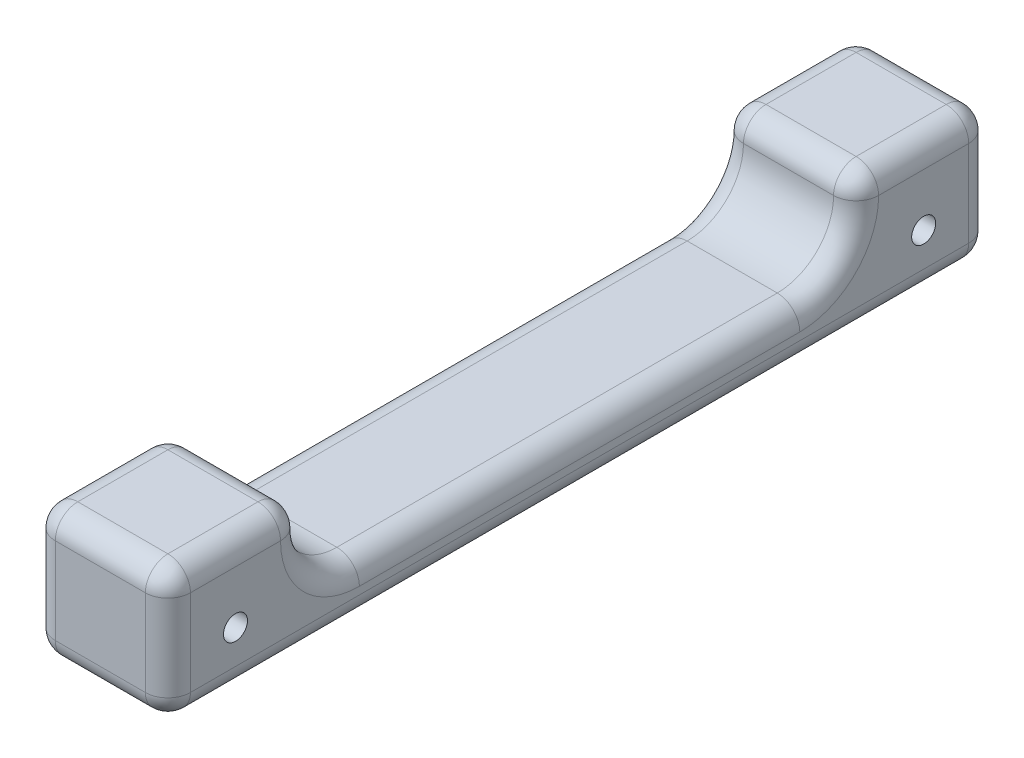
from build123d import *

# Parameters (mm, degrees)
SKETCH_1_W               = 18
SKETCH_1_H               = 18
SKETCH_1_W_2             = 12.4
SKETCH_1_H_2             = 12.4
EXTRUDE_1_DEPTH          = 15
SKETCH_2_W               = 18
SKETCH_2_H               = 18
EXTRUDE_1_2_DEPTH        = 2.5
FILLET_1_R               = 3
SKETCH_3_W               = 18
SKETCH_3_H               = 7
EXTRUDE_2_DEPTH          = 36.83
FILLET_2_R               = 7.5
FILLET_3_R               = 3
CUT_EXTRUDE_1_DEPTH      = 37
CUT_EXTRUDE_1_DEPTH_BACK = 37
SKETCH_6_R               = 1.6
FILLET_4_R               = 3


# Some blends are built 0.0001 mm under size
with BuildPart() as part:
    # 草图1 → Extrude 1 (new body)
    with BuildSketch(Plane(origin=(0, 0, 0), x_dir=(1, 0, 0), z_dir=(0, 1, 0))):
        Rectangle(SKETCH_1_W, SKETCH_1_H)
        Rectangle(SKETCH_1_W_2, SKETCH_1_H_2, mode=Mode.SUBTRACT)
    extrude(amount=EXTRUDE_1_DEPTH)

    # 草图2 → Extrude 1 2 (add)
    with BuildSketch(Plane(origin=(0, 15, 0), x_dir=(1, 0, 0), z_dir=(0, 1, 0))):
        Rectangle(SKETCH_2_W, SKETCH_2_H)
    extrude(amount=EXTRUDE_1_2_DEPTH)

    # 圆角1
    fillet_1_edges = [part.edges().sort_by_distance(p)[0] for p in [
        (-9, 17.5, 0),
        (0, 17.5, 9),
        (9, 17.5, 0),
        (0, 17.5, -9),
    ]]
    fillet(fillet_1_edges, radius=FILLET_1_R)

    # 草图3 → 凸台-拉伸2 (add)
    with BuildSketch(Plane.XY.offset(9)):
        with Locations((0, 3.5)):
            Rectangle(SKETCH_3_W, SKETCH_3_H)
    extrude(amount=EXTRUDE_2_DEPTH)

    # 圆角2
    fillet_2_edges = [part.edges().sort_by_distance(p)[0] for p in [
        (0, 7, 9),
    ]]
    fillet(fillet_2_edges, radius=FILLET_2_R - 0.0001)  # a hair under: the kernel refuses the full size

    # 圆角3
    # the kernel refuses this fillet: 3 mm, written as the material it takes off along each edge
    with BuildSketch(Plane(origin=(6, 14.5, -6), x_dir=(0, 0, -1), z_dir=(1, 0, 0))) as fillet_3_piece_1_section:
        Polygon((0, 0), (FILLET_3_R, 0), (FILLET_3_R, FILLET_3_R), (0, FILLET_3_R), align=None)
    fillet_3_piece_1 = extrude(amount=FILLET_3_R, mode=Mode.PRIVATE)
    fillet_3_piece_1 = fillet_3_piece_1 - Plane(origin=(6, 14.5, -6), x_dir=(0, -0.7071067811865475, 0.7071067811865475), z_dir=(1, 0, 0)) * Sphere(FILLET_3_R, mode=Mode.PRIVATE)
    add(fillet_3_piece_1, mode=Mode.SUBTRACT)
    with BuildSketch(Plane(origin=(-6, 14.5, -6), x_dir=(0, 0, -1), z_dir=(-1, 0, 0))) as fillet_3_piece_2_section:
        Polygon((0, 0), (FILLET_3_R, 0), (FILLET_3_R, -FILLET_3_R), (0, -FILLET_3_R), align=None)
    fillet_3_piece_2 = extrude(amount=FILLET_3_R, mode=Mode.PRIVATE)
    fillet_3_piece_2 = fillet_3_piece_2 - Plane(origin=(-6, 14.5, -6), x_dir=(0, -0.7071067811865475, 0.7071067811865475), z_dir=(-1, 0, 0)) * Sphere(FILLET_3_R, mode=Mode.PRIVATE)
    add(fillet_3_piece_2, mode=Mode.SUBTRACT)
    with BuildSketch(Plane(origin=(-9, 14.5, -9), x_dir=(0, 0, 1), z_dir=(0, -1, 0)), Plane(origin=(9, -7.5, -9), x_dir=(0, 0, 1), z_dir=(0, 1, 0))) as fillet_3_piece_3:
        with BuildLine():
            CenterArc((FILLET_3_R, -FILLET_3_R), FILLET_3_R, 90, 90)
            Line((0, -FILLET_3_R), (0, 0))
            Line((0, 0), (FILLET_3_R, 0))
        make_face()
    extrude(amount=22, mode=Mode.SUBTRACT)

    # 草图6 → 切除-拉伸1 (cut, two sides: drawn at the far end of the back side and taken through both)
    with BuildSketch(Plane(origin=(-6.2, 0, 0), x_dir=(0, 0, -1), z_dir=(1, 0, 0)).offset(-CUT_EXTRUDE_1_DEPTH_BACK)):
        with Locations((0, 7.5)):
            Circle(SKETCH_6_R)
    extrude(amount=CUT_EXTRUDE_1_DEPTH + CUT_EXTRUDE_1_DEPTH_BACK, mode=Mode.SUBTRACT)

    # 镜向1: part across plane


with BuildPart() as part_1:
    add(part.part)
    add(part.part.mirror(Plane(origin=(0, 0, 45.83), x_dir=(1, 0, 0), z_dir=(0, 0, -1))))

    # 圆角4
    # the kernel refuses this fillet: 3 mm, written as the material it takes off along each edge
    with BuildSketch(Plane(origin=(6, 14.5, 85.66), x_dir=(0, 0, -1), z_dir=(1, 0, 0))) as fillet_4_piece_1_section:
        Polygon((0, 0), (FILLET_4_R, 0), (FILLET_4_R, FILLET_4_R), (0, FILLET_4_R), align=None)
    fillet_4_piece_1 = extrude(amount=FILLET_4_R, mode=Mode.PRIVATE)
    fillet_4_piece_1 = fillet_4_piece_1 - Plane(origin=(6, 14.5, 85.66), x_dir=(0, -0.7071067811865475, 0.7071067811865475), z_dir=(1, 0, 0)) * Sphere(FILLET_4_R, mode=Mode.PRIVATE)
    add(fillet_4_piece_1, mode=Mode.SUBTRACT)
    with BuildSketch(Plane(origin=(6, 14.5, 6), x_dir=(1, 0, 0), z_dir=(0, 0, 1))) as fillet_4_piece_2_section:
        Polygon((0, 0), (FILLET_4_R, 0), (FILLET_4_R, FILLET_4_R), (0, FILLET_4_R), align=None)
    fillet_4_piece_2 = extrude(amount=FILLET_4_R, mode=Mode.PRIVATE)
    fillet_4_piece_2 = fillet_4_piece_2 - Plane(origin=(6, 14.5, 6), x_dir=(-0.7071067811865475, -0.7071067811865475, 0), z_dir=(0, 0, 1)) * Sphere(FILLET_4_R, mode=Mode.PRIVATE)
    add(fillet_4_piece_2, mode=Mode.SUBTRACT)
    with BuildSketch(Plane(origin=(-6, 14.5, 85.66), x_dir=(-1, 0, 0), z_dir=(0, 0, -1))) as fillet_4_piece_3_section:
        Polygon((0, 0), (FILLET_4_R, 0), (FILLET_4_R, FILLET_4_R), (0, FILLET_4_R), align=None)
    fillet_4_piece_3 = extrude(amount=FILLET_4_R, mode=Mode.PRIVATE)
    fillet_4_piece_3 = fillet_4_piece_3 - Plane(origin=(-6, 14.5, 85.66), x_dir=(0.7071067811865475, -0.7071067811865475, 0), z_dir=(0, 0, -1)) * Sphere(FILLET_4_R, mode=Mode.PRIVATE)
    add(fillet_4_piece_3, mode=Mode.SUBTRACT)
    with BuildSketch(Plane(origin=(-6, 14.5, 6), x_dir=(-1, 0, 0), z_dir=(0, 0, 1))) as fillet_4_piece_4_section:
        Polygon((0, 0), (FILLET_4_R, 0), (FILLET_4_R, -FILLET_4_R), (0, -FILLET_4_R), align=None)
    fillet_4_piece_4 = extrude(amount=FILLET_4_R, mode=Mode.PRIVATE)
    fillet_4_piece_4 = fillet_4_piece_4 - Plane(origin=(-6, 14.5, 6), x_dir=(0.7071067811865475, -0.7071067811865475, 0), z_dir=(0, 0, 1)) * Sphere(FILLET_4_R, mode=Mode.PRIVATE)
    add(fillet_4_piece_4, mode=Mode.SUBTRACT)
    with BuildSketch(Plane(origin=(9, 14.4999, 75.1601), x_dir=(0, 0, 1), z_dir=(0, 1, 0))) as fillet_4_piece_5:
        with BuildLine():
            CenterArc((7.4999 + FILLET_4_R, -FILLET_4_R), FILLET_4_R, 90, 90)
            Line((7.4999, -FILLET_4_R), (7.4999, 0))
            Line((7.4999, 0), (7.4999 + FILLET_4_R, 0))
        make_face()
    revolve(axis=Axis((9, 14.4999, 75.1601), (1, 0, 0)), revolution_arc=90, mode=Mode.SUBTRACT)
    with BuildSketch(Plane(origin=(-9, 14.4999, 75.1601), x_dir=(0, 0, 1), z_dir=(0, 1, 0))) as fillet_4_piece_6:
        with BuildLine():
            CenterArc((7.4999 + FILLET_4_R, FILLET_4_R), FILLET_4_R, 180, 90)
            Line((7.4999 + FILLET_4_R, 0), (7.4999, 0))
            Line((7.4999, 0), (7.4999, FILLET_4_R))
        make_face()
    revolve(axis=Axis((-9, 14.4999, 75.1601), (1, 0, 0)), revolution_arc=90, mode=Mode.SUBTRACT)
    with BuildSketch(Plane(origin=(9, 14.4999, 16.4999), x_dir=(0, 0, -1), z_dir=(0, 1, 0))) as fillet_4_piece_7:
        with BuildLine():
            CenterArc((7.4999 + FILLET_4_R, FILLET_4_R), FILLET_4_R, 180, 90)
            Line((7.4999, FILLET_4_R), (7.4999, 0))
            Line((7.4999, 0), (7.4999 + FILLET_4_R, 0))
        make_face()
    revolve(axis=Axis((9, 14.4999, 16.4999), (-1, 0, 0)), revolution_arc=90, mode=Mode.SUBTRACT)
    with BuildSketch(Plane(origin=(-9, 14.4999, 16.4999), x_dir=(0, 0, -1), z_dir=(0, 1, 0))) as fillet_4_piece_8:
        with BuildLine():
            CenterArc((7.4999 + FILLET_4_R, -FILLET_4_R), FILLET_4_R, 90, 90)
            Line((7.4999 + FILLET_4_R, 0), (7.4999, 0))
            Line((7.4999, 0), (7.4999, -FILLET_4_R))
        make_face()
    revolve(axis=Axis((-9, 14.4999, 16.4999), (-1, 0, 0)), revolution_arc=90, mode=Mode.SUBTRACT)
    with BuildSketch(Plane(origin=(9, 0, 97.66), x_dir=(0, 1, 0), z_dir=(0, 0, -1))) as fillet_4_piece_9:
        with BuildLine():
            CenterArc((FILLET_4_R, -FILLET_4_R), FILLET_4_R, 90, 90)
            Line((0, -FILLET_4_R), (0, 0))
            Line((0, 0), (FILLET_4_R, 0))
        make_face()
    extrude(amount=103.66, mode=Mode.SUBTRACT)
    with BuildSketch(Plane(origin=(-9, 0, -6), x_dir=(1, 0, 0), z_dir=(0, 0, 1))) as fillet_4_piece_10:
        with BuildLine():
            CenterArc((FILLET_4_R, FILLET_4_R), FILLET_4_R, 180, 90)
            Line((0, FILLET_4_R), (0, 0))
            Line((0, 0), (FILLET_4_R, 0))
        make_face()
    extrude(amount=103.66, mode=Mode.SUBTRACT)
    with BuildSketch(Plane(origin=(9, 7, 16.4999), x_dir=(0, -1, 0), z_dir=(0, 0, 1))) as fillet_4_piece_11:
        with BuildLine():
            CenterArc((FILLET_4_R, -FILLET_4_R), FILLET_4_R, 90, 90)
            Line((0, -FILLET_4_R), (0, 0))
            Line((0, 0), (FILLET_4_R, 0))
        make_face()
    extrude(amount=58.6602, mode=Mode.SUBTRACT)
    with BuildSketch(Plane(origin=(-9, 7, 75.1601), x_dir=(1, 0, 0), z_dir=(0, 0, -1))) as fillet_4_piece_12:
        with BuildLine():
            CenterArc((FILLET_4_R, FILLET_4_R), FILLET_4_R, 180, 90)
            Line((0, FILLET_4_R), (0, 0))
            Line((0, 0), (FILLET_4_R, 0))
        make_face()
    extrude(amount=58.6602, mode=Mode.SUBTRACT)
    with BuildSketch(Plane(origin=(-6, 0, -6), x_dir=(0, 0, -1), z_dir=(1, 0, 0))) as fillet_4_piece_13:
        with BuildLine():
            CenterArc((3 - FILLET_4_R, FILLET_4_R), FILLET_4_R, 270, 90)
            Line((3 - FILLET_4_R, 0), (3, 0))
            Line((3, 0), (3, FILLET_4_R))
        make_face()
    revolve(axis=Axis((-6, 0, -6), (0, 1, 0)), revolution_arc=90, mode=Mode.SUBTRACT)
    with BuildSketch(Plane(origin=(-6, 0, 97.66), x_dir=(0, 0, 1), z_dir=(1, 0, 0))) as fillet_4_piece_14:
        with BuildLine():
            CenterArc((3 - FILLET_4_R, -FILLET_4_R), FILLET_4_R, 0, 90)
            Line((3, -FILLET_4_R), (3, 0))
            Line((3, 0), (3 - FILLET_4_R, 0))
        make_face()
    revolve(axis=Axis((-6, 0, 97.66), (0, -1, 0)), revolution_arc=90, mode=Mode.SUBTRACT)
    with BuildSketch(Plane(origin=(-6, 0, 100.66), x_dir=(0, 0, -1), z_dir=(1, 0, 0)), Plane(origin=(-6, 0, -9), x_dir=(0, 1, 0), z_dir=(1, 0, 0))) as fillet_4_piece_15:
        with BuildLine():
            CenterArc((FILLET_4_R, FILLET_4_R), FILLET_4_R, 180, 90)
            Line((0, FILLET_4_R), (0, 0))
            Line((0, 0), (FILLET_4_R, 0))
        make_face()
    extrude(amount=12, mode=Mode.SUBTRACT)
    with BuildSketch(Plane(origin=(6, 0, 97.66), x_dir=(0, 0, 1), z_dir=(-1, 0, 0))) as fillet_4_piece_16:
        with BuildLine():
            CenterArc((3 - FILLET_4_R, FILLET_4_R), FILLET_4_R, 270, 90)
            Line((3, FILLET_4_R), (3, 0))
            Line((3, 0), (3 - FILLET_4_R, 0))
        make_face()
    revolve(axis=Axis((6, 0, 97.66), (0, 1, 0)), revolution_arc=90, mode=Mode.SUBTRACT)
    with BuildSketch(Plane(origin=(6, 0, -6), x_dir=(0, 0, -1), z_dir=(-1, 0, 0))) as fillet_4_piece_17:
        with BuildLine():
            CenterArc((3 - FILLET_4_R, -FILLET_4_R), FILLET_4_R, 0, 90)
            Line((3 - FILLET_4_R, 0), (3, 0))
            Line((3, 0), (3, -FILLET_4_R))
        make_face()
    revolve(axis=Axis((6, 0, -6), (0, -1, 0)), revolution_arc=90, mode=Mode.SUBTRACT)
    with BuildSketch(Plane(origin=(-9, 14.5, 9), x_dir=(1, 0, 0), z_dir=(0, -1, 0)), Plane(origin=(9, 14.4999, 9), x_dir=(-1, 0, 0), z_dir=(0, 1, 0)), Plane(origin=(9, 14.4999, 82.66), x_dir=(0, 0, 1), z_dir=(0, 1, 0))) as fillet_4_piece_18:
        with BuildLine():
            CenterArc((FILLET_4_R, -FILLET_4_R), FILLET_4_R, 90, 90)
            Line((0, -FILLET_4_R), (0, 0))
            Line((0, 0), (FILLET_4_R, 0))
        make_face()
    extrude(amount=0.0001, mode=Mode.SUBTRACT)
    with BuildSketch(Plane(origin=(-9, 14.5, 82.66), x_dir=(1, 0, 0), z_dir=(0, -1, 0))) as fillet_4_piece_19:
        with BuildLine():
            CenterArc((FILLET_4_R, FILLET_4_R), FILLET_4_R, 180, 90)
            Line((0, FILLET_4_R), (0, 0))
            Line((0, 0), (FILLET_4_R, 0))
        make_face()
    extrude(amount=0.0001, mode=Mode.SUBTRACT)


solid = part_1.part
